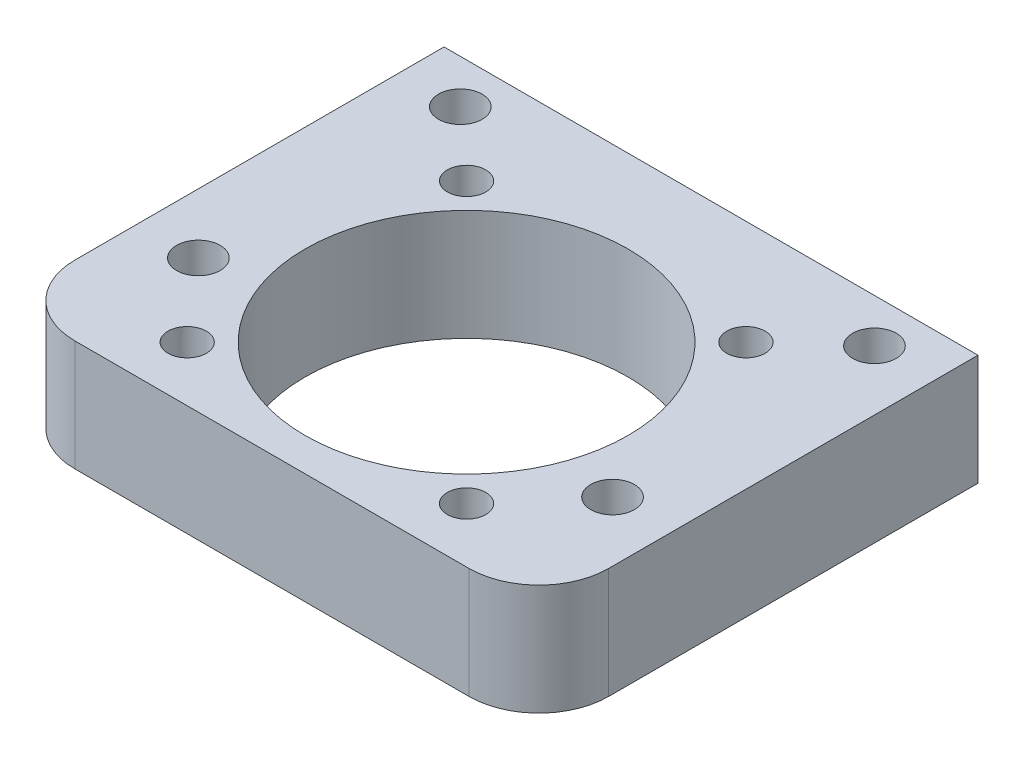
from build123d import *

# Parameters (mm, degrees)
BOSS_EXTRUDE1_DEPTH          = 6.35
F_2_2_2_2_DIAMETER_HOLE1_D   = 2.2
F_2_2_2_2_DIAMETER_HOLE2_D   = 2.2
F_2_2_2_2_DIAMETER_HOLE3_D   = 2.2
F_2_2_2_2_DIAMETER_HOLE4_D   = 2.2
F_18_5_18_5_DIAMETER_HOLE1_D = 18.5
M3_TAPPED_HOLE1_D            = 2.5
M3_TAPPED_HOLE2_D            = 2.5
M3_TAPPED_HOLE3_D            = 2.5
M3_TAPPED_HOLE4_D            = 2.5


with BuildPart() as part:
    # Sketch1 → Boss-Extrude1 (new body)
    with BuildSketch(Plane(origin=(0, 6.35, 0), x_dir=(1, 0, 0), z_dir=(0, 1, 0))):
        with BuildLine():
            Line((15.288980095, -7.15), (15.288980095, 14))
            Line((15.288980095, 14), (-15.289019905, 14))
            Line((-15.289019905, 14), (-15.289019905, -7.15))
            ThreePointArc((-15.289019905, -7.15), (-14.11744703, -9.978427125), (-11.289019905, -11.15))
            Line((-11.289019905, -11.15), (11.288980095, -11.15))
            ThreePointArc((11.288980095, -11.15), (14.11740722, -9.978427125), (15.288980095, -7.15))
        make_face()
    extrude(amount=-BOSS_EXTRUDE1_DEPTH)

    # Ø2.2 (2.2) Diameter Hole1 (through all)
    with Locations(Plane(origin=(0, 0, 0), x_dir=(-1, 0, 0), z_dir=(0, -1, 0))):
        with Locations((-7.999980095, -8)):
            Hole(F_2_2_2_2_DIAMETER_HOLE1_D / 2)

    # Ø2.2 (2.2) Diameter Hole2 (through all)
    with Locations(Plane(origin=(0, 0, 0), x_dir=(-1, 0, 0), z_dir=(0, -1, 0))):
        with Locations((8.000019905, 8)):
            Hole(F_2_2_2_2_DIAMETER_HOLE2_D / 2)

    # Ø2.2 (2.2) Diameter Hole3 (through all)
    with Locations(Plane(origin=(0, 0, 0), x_dir=(-1, 0, 0), z_dir=(0, -1, 0))):
        with Locations((-7.999980095, 8)):
            Hole(F_2_2_2_2_DIAMETER_HOLE3_D / 2)

    # Ø2.2 (2.2) Diameter Hole4 (through all)
    with Locations(Plane(origin=(0, 6.35, 0), x_dir=(1, 0, 0), z_dir=(0, 1, 0))):
        with Locations((-8.000019905, -8)):
            Hole(F_2_2_2_2_DIAMETER_HOLE4_D / 2)

    # Ø18.5 (18.5) Diameter Hole1 (through all)
    with Locations(Plane(origin=(0, 0, 0), x_dir=(-1, 0, 0), z_dir=(0, -1, 0))):
        with Locations((0, 0)):
            Hole(F_18_5_18_5_DIAMETER_HOLE1_D / 2)

    # M3 Tapped Hole1 (through all)
    with Locations(Plane(origin=(0, 0, 0), x_dir=(-1, 0, 0), z_dir=(0, -1, 0))):
        with Locations((11.858637076, 11.5)):
            Hole(M3_TAPPED_HOLE1_D / 2)

    # M3 Tapped Hole2 (through all)
    with Locations(Plane(origin=(0, 0, 0), x_dir=(-1, 0, 0), z_dir=(0, -1, 0))):
        with Locations((11.85956559, -3.500033723)):
            Hole(M3_TAPPED_HOLE2_D / 2)

    # M3 Tapped Hole3 (through all)
    with Locations(Plane(origin=(0, 0, 0), x_dir=(-1, 0, 0), z_dir=(0, -1, 0))):
        with Locations((-11.858647005, 11.5)):
            Hole(M3_TAPPED_HOLE3_D / 2)

    # M3 Tapped Hole4 (through all)
    with Locations(Plane(origin=(0, 0, 0), x_dir=(-1, 0, 0), z_dir=(0, -1, 0))):
        with Locations((-11.859575542, -3.5)):
            Hole(M3_TAPPED_HOLE4_D / 2)


solid = part.part
